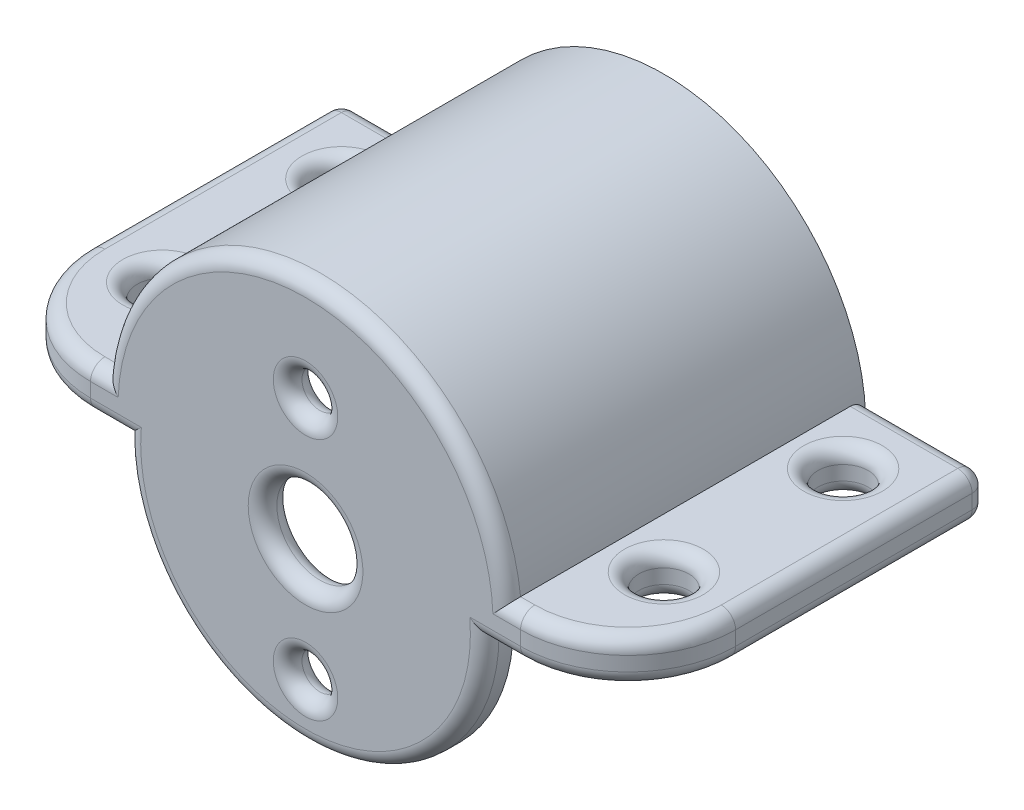
from build123d import *

# Parameters (mm, degrees)
SKETCH1_W             = 10
SKETCH1_H             = 25
SKETCH1_R             = 1.75
BOSS_EXTRUDE1_DEPTH   = 3
BOSS_EXTRUDE1_2_DEPTH = 3
BOSS_EXTRUDE2_DEPTH   = 25
SKETCH3_R             = 12.5
SKETCH3_R_2           = 1.25
SKETCH3_R_3           = 3
BOSS_EXTRUDE3_DEPTH   = 2
FILLET1_R             = 7.5
FILLET2_R             = 1
FILLET3_R             = 1


with BuildPart() as part:
    # Sketch1 → Boss-Extrude1 (new body)
    with BuildSketch(Plane(origin=(0, 0, 0), x_dir=(1, 0, 0), z_dir=(0, 1, 0))):
        with Locations((-17.5, 12.5)):
            Rectangle(SKETCH1_W, SKETCH1_H)
        with Locations(Location((-17.5, 20, 0), (0, 0, 270))):
            Circle(SKETCH1_R, mode=Mode.SUBTRACT)
        with Locations(Location((-17.5, 7.5, 0), (0, 0, 270))):
            Circle(SKETCH1_R, mode=Mode.SUBTRACT)
    extrude(amount=BOSS_EXTRUDE1_DEPTH)



with BuildPart() as body_2:
    # Sketch1 → Boss-Extrude1 2 (new body)
    with BuildSketch(Plane(origin=(0, 0, 0), x_dir=(1, 0, 0), z_dir=(0, 1, 0))):
        with Locations((17.5, 12.5)):
            Rectangle(SKETCH1_W, SKETCH1_H)
        with Locations(Location((17.5, 20, 0), (0, 0, 270))):
            Circle(SKETCH1_R, mode=Mode.SUBTRACT)
        with Locations(Location((17.5, 7.5, 0), (0, 0, 270))):
            Circle(SKETCH1_R, mode=Mode.SUBTRACT)
    extrude(amount=BOSS_EXTRUDE1_2_DEPTH)


with BuildPart() as part_1:
    add(part.part)

    add(body_2.part)  # Boss-Extrude2 merges body 2
    # Sketch2 → Boss-Extrude2 (add)
    with BuildSketch(Plane.XY):
        with BuildLine():
            Line((-14, 0), (-12.5, 0))
            ThreePointArc((-12.5, 0), (0, 12.5), (12.5, 0))
            Line((12.5, 0), (14, 0))
            ThreePointArc((14, 0), (0, 15.58012784), (-14, 0))
        make_face()
    extrude(amount=-BOSS_EXTRUDE2_DEPTH)

    # Sketch3 → Boss-Extrude3 (add)
    with BuildSketch(Plane.XY):
        Circle(SKETCH3_R)
        with Locations((0, 8.5)):
            Circle(SKETCH3_R_2, mode=Mode.SUBTRACT)
        with Locations((0, -8.5)):
            Circle(SKETCH3_R_2, mode=Mode.SUBTRACT)
        Circle(SKETCH3_R_3, mode=Mode.SUBTRACT)
    extrude(amount=-BOSS_EXTRUDE3_DEPTH)

    # Fillet1
    fillet1_edges = [part_1.edges().sort_by_distance(p)[0] for p in [
        (22.5, 1.5, 0),
        (-22.5, 1.5, 0),
    ]]
    fillet(fillet1_edges, radius=FILLET1_R)

    # Fillet2
    fillet2_edges = [part_1.edges().sort_by_distance(p)[0] for p in [
        (-17.5, 0, -21.75),
        (-17.5, 3, -21.75),
        (-17.5, 0, -9.25),
        (-17.5, 3, -9.25),
        (12.5, 0, -13.5),
        (13.75, 0, 0),
        (0, 15.58012784, 0),
        (14.5, 3, 0),
        (17.5, 0, -21.75),
        (17.5, 0, -9.25),
        (17.5, 3, -21.75),
        (17.5, 3, -9.25),
        (-22.5, 3, -16.25),
        (-12.5, 0, -13.5),
        (0, -12.5, 0),
        (-1.25, 8.5, 0),
        (-1.25, -8.5, 0),
        (-3, 0, 0),
        (-22.5, 0, -16.25),
        (-3, 0, -2),
        (-1.25, -8.5, -2),
        (-1.25, 8.5, -2),
        (-14.5, 3, 0),
        (-13.75, 0, 0),
        (-20.303300859, 0, -2.196699141),
        (-20.303300859, 3, -2.196699141),
        (22.5, 0, -16.25),
        (22.5, 3, -16.25),
        (20.303300859, 0, -2.196699141),
        (20.303300859, 3, -2.196699141),
    ]]
    fillet(fillet2_edges, radius=FILLET2_R - 0.0001)  # a hair under: the kernel refuses the full size

    # Fillet3
    fillet3_edges = [part_1.edges().sort_by_distance(p)[0] for p in [
        (22.207136071, 0.292863929, -25),
        (22.207136071, 2.707136071, -25),
        (-17.75005, 3, -25),
        (17.75005, 3, -25),
        (22.5, 1.5, -25),
        (17.481459585, 0, -25),
        (0, 12.5, -25),
        (-17.481459585, 0, -25),
        (-22.5, 1.5, -25),
        (12.782470874, 0.267147514, -25),
        (-12.782470874, 0.267147514, -25),
        (-22.207136071, 2.707136071, -25),
        (-22.207136071, 0.292863929, -25),
    ]]
    fillet(fillet3_edges, radius=FILLET3_R - 0.0001)  # a hair under: the kernel refuses the full size


solid = part_1.part
